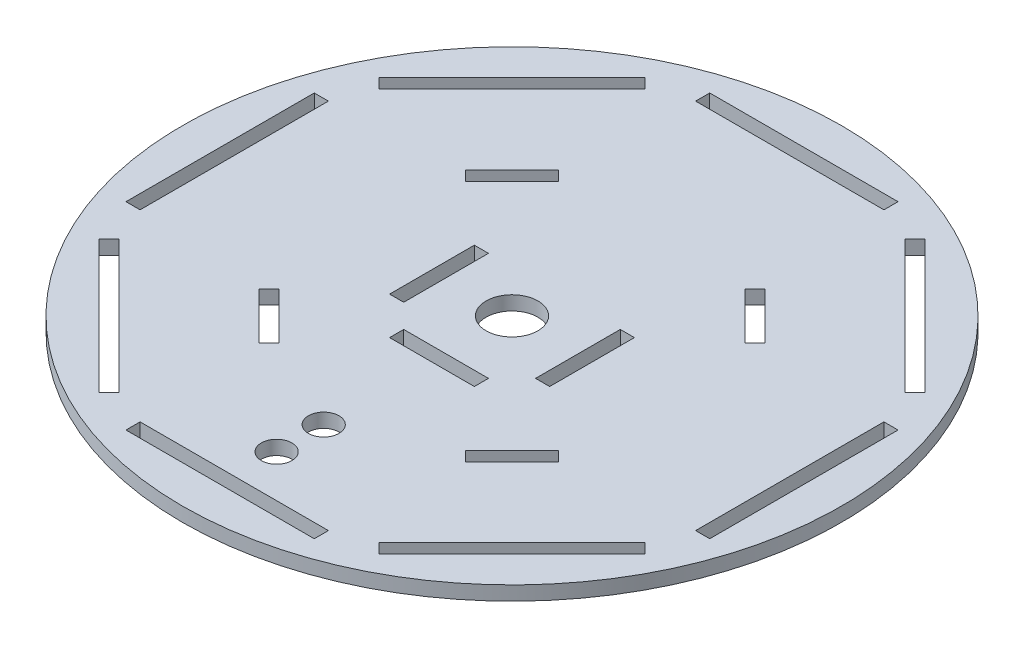
from build123d import *

# Parameters (mm, degrees)
CROQUIS1_R              = 70
CROQUIS1_R_2            = 5.5
CROQUIS1_R_3            = 3.25
SALIENTE_EXTRUIR1_DEPTH = 3


with BuildPart() as part:
    # Croquis1 → Saliente-Extruir1 (new body)
    with BuildSketch(Plane(origin=(0, 0, 0), x_dir=(1, 0, 0), z_dir=(0, 1, 0))):
        Circle(CROQUIS1_R)
        Circle(CROQUIS1_R_2, mode=Mode.SUBTRACT)
        with Locations((0, -50)):
            Circle(CROQUIS1_R_3, mode=Mode.SUBTRACT)
        with Locations((0, -40)):
            Circle(CROQUIS1_R_3, mode=Mode.SUBTRACT)
        Polygon((24.748737342, 24.748737342), (29.69848481, 19.798989873), (31.819805153, 21.920310217), (21.920310217, 31.819805153), (19.798989873, 29.69848481), align=None, mode=Mode.SUBTRACT)
        Polygon((24.748737342, -24.748737342), (19.798989873, -29.69848481), (21.920310217, -31.819805153), (31.819805153, -21.920310217), (29.69848481, -19.798989873), align=None, mode=Mode.SUBTRACT)
        Polygon((-24.748737342, 24.748737342), (-19.798989873, 29.69848481), (-21.920310217, 31.819805153), (-31.819805153, 21.920310217), (-29.69848481, 19.798989873), align=None, mode=Mode.SUBTRACT)
        Polygon((-24.748737342, -24.748737342), (-29.69848481, -19.798989873), (-31.819805153, -21.920310217), (-21.920310217, -31.819805153), (-19.798989873, -29.69848481), align=None, mode=Mode.SUBTRACT)
        Polygon((-14, 0), (-14, 9), (-17, 9), (-17, -9), (-14, -9), align=None, mode=Mode.SUBTRACT)
        Polygon((14, -9), (17, -9), (17, 9), (14, 9), (14, 0), align=None, mode=Mode.SUBTRACT)
        Polygon((-9, -14), (-9, -17), (9, -17), (9, -14), (0, -14), align=None, mode=Mode.SUBTRACT)
        Polygon((0, 62), (20, 62), (20, 59), (-20, 59), (-20, 62), align=None, mode=Mode.SUBTRACT)
        Polygon((55.861435714, 27.577164466), (27.577164466, 55.861435714), (29.69848481, 57.982756057), (43.840620434, 43.840620434), (57.982756057, 29.69848481), align=None, mode=Mode.SUBTRACT)
        Polygon((59, -20), (59, 20), (62, 20), (62, 0), (62, -20), align=None, mode=Mode.SUBTRACT)
        Polygon((27.577164466, -55.861435714), (55.861435714, -27.577164466), (57.982756057, -29.69848481), (43.840620434, -43.840620434), (29.69848481, -57.982756057), align=None, mode=Mode.SUBTRACT)
        Polygon((-20, -59), (20, -59), (20, -62), (0, -62), (-20, -62), align=None, mode=Mode.SUBTRACT)
        Polygon((-55.861435714, -27.577164466), (-27.577164466, -55.861435714), (-29.69848481, -57.982756057), (-43.840620434, -43.840620434), (-57.982756057, -29.69848481), align=None, mode=Mode.SUBTRACT)
        Polygon((-59, 20), (-59, -20), (-62, -20), (-62, 0), (-62, 20), align=None, mode=Mode.SUBTRACT)
        Polygon((-27.577164466, 55.861435714), (-55.861435714, 27.577164466), (-57.982756057, 29.69848481), (-43.840620434, 43.840620434), (-29.69848481, 57.982756057), align=None, mode=Mode.SUBTRACT)
    extrude(amount=SALIENTE_EXTRUIR1_DEPTH)


solid = part.part
